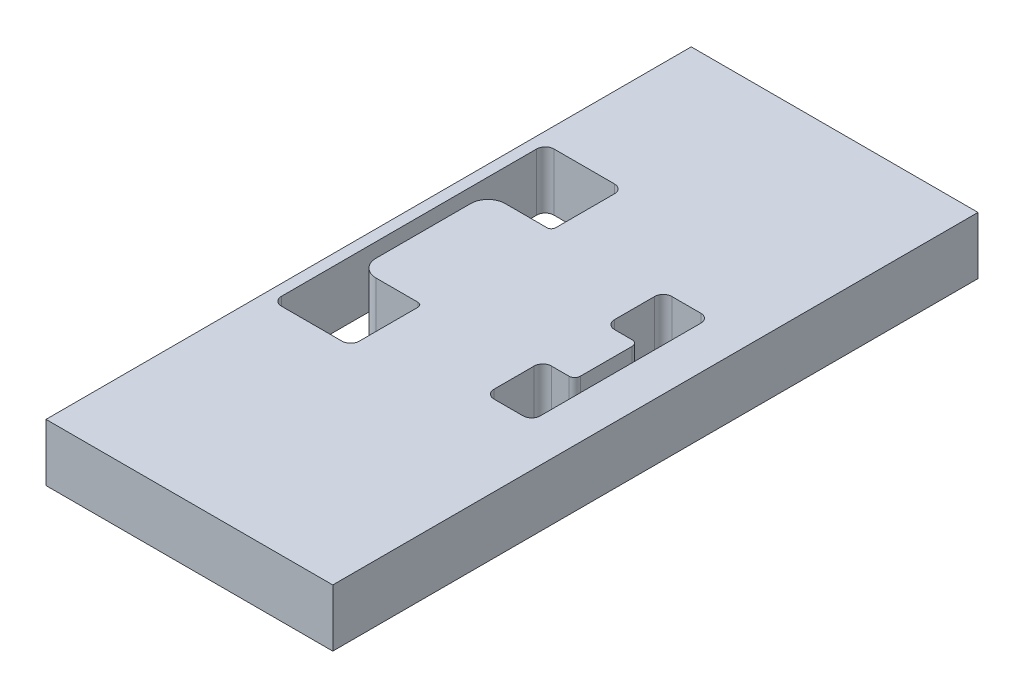
from build123d import *

# Parameters (mm, degrees)
SKETCH1_W           = 100
SKETCH1_H           = 225
BOSS_EXTRUDE1_DEPTH = 20
CUT_EXTRUDE1_REACH  = 126.725
CUT_EXTRUDE2_REACH  = 126.725


with BuildPart() as part:
    # Sketch1 → Boss-Extrude1 (new body)
    with BuildSketch(Plane(origin=(0, 0, 0), x_dir=(1, 0, 0), z_dir=(0, 1, 0))):
        Rectangle(SKETCH1_W, SKETCH1_H)
    extrude(amount=BOSS_EXTRUDE1_DEPTH)

    # Sketch2 → Cut-Extrude1 (cut, up to next)
    with BuildSketch(Plane(origin=(0, 20, 0), x_dir=(1, 0, 0), z_dir=(0, 1, 0)), mode=Mode.PRIVATE) as cut_extrude1_sk1:
        with BuildLine():
            Line((-43.12, -37.27), (-22, -37.27))
            ThreePointArc((-22, -37.27), (-19.878679656, -36.391320344), (-19, -34.27))
            Line((-19, -34.27), (-19, -13.77))
            ThreePointArc((-19, -13.77), (-19.439339828, -12.709339828), (-20.5, -12.27))
            Line((-20.5, -12.27), (-35.12, -12.27))
            ThreePointArc((-35.12, -12.27), (-39.362640687, -10.512640687), (-41.12, -6.27))
            Line((-41.12, -6.27), (-41.12, 26.73))
            ThreePointArc((-41.12, 26.73), (-39.362640687, 30.972640687), (-35.12, 32.73))
            Line((-35.12, 32.73), (-20.5, 32.73))
            ThreePointArc((-20.5, 32.73), (-19.439339828, 33.169339828), (-19, 34.23))
            Line((-19, 34.23), (-19, 54.73))
            ThreePointArc((-19, 54.73), (-19.878679656, 56.851320344), (-22, 57.73))
            Line((-22, 57.73), (-43.12, 57.73))
            ThreePointArc((-43.12, 57.73), (-45.241320344, 56.851320344), (-46.12, 54.73))
            Line((-46.12, 54.73), (-46.12, -34.27))
            ThreePointArc((-46.12, -34.27), (-45.241320344, -36.391320344), (-43.12, -37.27))
        make_face()
    cut_extrude1_tool1 = extrude(cut_extrude1_sk1.sketch, amount=-CUT_EXTRUDE1_REACH, mode=Mode.PRIVATE) & part.part
    add(cut_extrude1_tool1.solids().sort_by_distance((-44.542733, 20, 35.692733))[0], mode=Mode.SUBTRACT)

    # Sketch3 → Cut-Extrude2 (cut, up to next)
    with BuildSketch(Plane(origin=(0, 20, 0), x_dir=(1, 0, 0), z_dir=(0, 1, 0)), mode=Mode.PRIVATE) as cut_extrude2_sk1:
        with BuildLine():
            Line((22, -8.27), (28.13, -8.27))
            ThreePointArc((28.13, -8.27), (29.544213562, -7.684213562), (30.13, -6.27))
            Line((30.13, -6.27), (30.13, 11.73))
            ThreePointArc((30.13, 11.73), (29.544213562, 13.144213562), (28.13, 13.73))
            Line((28.13, 13.73), (22, 13.73))
            ThreePointArc((22, 13.73), (19.878679656, 14.608679656), (19, 16.73))
            Line((19, 16.73), (19, 30.73))
            ThreePointArc((19, 30.73), (19.878679656, 32.851320344), (22, 33.73))
            Line((22, 33.73), (32.13, 33.73))
            ThreePointArc((32.13, 33.73), (34.251320344, 32.851320344), (35.13, 30.73))
            Line((35.13, 30.73), (35.13, -25.27))
            ThreePointArc((35.13, -25.27), (34.251320344, -27.391320344), (32.13, -28.27))
            Line((32.13, -28.27), (22, -28.27))
            ThreePointArc((22, -28.27), (19.878679656, -27.391320344), (19, -25.27))
            Line((19, -25.27), (19, -11.27))
            ThreePointArc((19, -11.27), (19.878679656, -9.148679656), (22, -8.27))
        make_face()
    cut_extrude2_tool1 = extrude(cut_extrude2_sk1.sketch, amount=-CUT_EXTRUDE2_REACH, mode=Mode.PRIVATE) & part.part
    add(cut_extrude2_tool1.solids().sort_by_distance((27.065, 20, 27.629361))[0], mode=Mode.SUBTRACT)


solid = part.part
